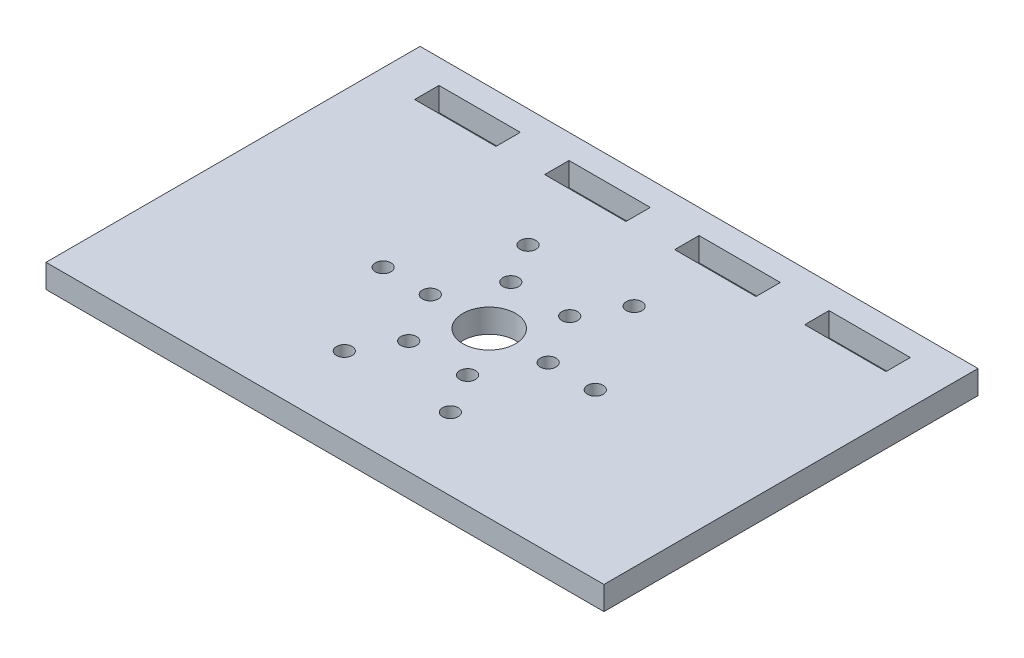
from build123d import *

# Parameters (mm, degrees)
SKETCH2_R           = 1
SKETCH2_R_2         = 3.35
SKETCH2_W           = 10.344
SKETCH2_H           = 3.1
BOSS_EXTRUDE1_DEPTH = 3


with BuildPart() as part:
    # Sketch2 → Boss-Extrude1 (new body)
    with BuildSketch(Plane(origin=(0, 0, 0), x_dir=(1, 0, 0), z_dir=(0, 1, 0))):
        Polygon((0, 44.5), (0, 0), (71, 0), (71, 47.6), (0, 47.6), align=None)
        with Locations((28.75, 9.208657049)):
            Circle(SKETCH2_R, mode=Mode.SUBTRACT)
        with Locations((31.75, 14.404809472)):
            Circle(SKETCH2_R, mode=Mode.SUBTRACT)
        with Locations((22, 20.9)):
            Circle(SKETCH2_R, mode=Mode.SUBTRACT)
        with Locations((28, 20.9)):
            Circle(SKETCH2_R, mode=Mode.SUBTRACT)
        with Locations((42.25, 9.208657049)):
            Circle(SKETCH2_R, mode=Mode.SUBTRACT)
        with Locations((39.25, 14.404809472)):
            Circle(SKETCH2_R, mode=Mode.SUBTRACT)
        with Locations((35.5, 20.9)):
            Circle(SKETCH2_R_2, mode=Mode.SUBTRACT)
        with Locations((43, 20.9)):
            Circle(SKETCH2_R, mode=Mode.SUBTRACT)
        with Locations((49, 20.9)):
            Circle(SKETCH2_R, mode=Mode.SUBTRACT)
        with Locations((31.75, 27.395190528)):
            Circle(SKETCH2_R, mode=Mode.SUBTRACT)
        with Locations((28.75, 32.591342951)):
            Circle(SKETCH2_R, mode=Mode.SUBTRACT)
        with Locations((10.684, 42.95)):
            Rectangle(SKETCH2_W, SKETCH2_H, mode=Mode.SUBTRACT)
        with Locations((27.228, 42.95)):
            Rectangle(SKETCH2_W, SKETCH2_H, mode=Mode.SUBTRACT)
        with Locations((39.25, 27.395190528)):
            Circle(SKETCH2_R, mode=Mode.SUBTRACT)
        with Locations((42.25, 32.591342951)):
            Circle(SKETCH2_R, mode=Mode.SUBTRACT)
        with Locations((43.772, 42.95)):
            Rectangle(SKETCH2_W, SKETCH2_H, mode=Mode.SUBTRACT)
        with Locations((60.316, 42.95)):
            Rectangle(SKETCH2_W, SKETCH2_H, mode=Mode.SUBTRACT)
    extrude(amount=BOSS_EXTRUDE1_DEPTH)


solid = part.part
